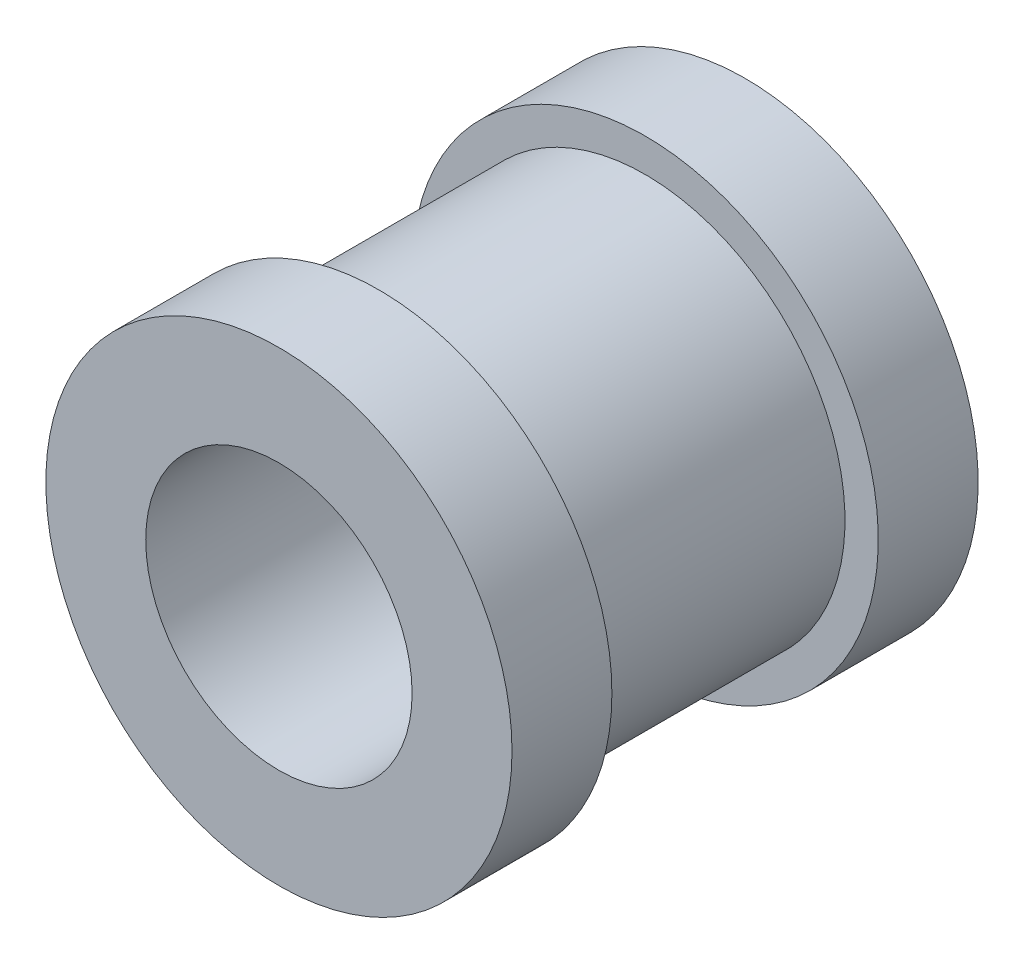
from build123d import *

# Parameters (mm, degrees)
SKETCH1_R           = 6
SKETCH1_R_2         = 4
BOSS_EXTRUDE1_DEPTH = 7
BOSS_EXTRUDE2_START = -3
SKETCH2_R           = 7
SKETCH2_R_2         = 6
BOSS_EXTRUDE2_DEPTH = 3
SKETCH3_R           = 7
SKETCH3_R_2         = 6
BOSS_EXTRUDE3_DEPTH = 3


with BuildPart() as part:
    # Sketch1 → Boss-Extrude1 (new, symmetric)
    with BuildSketch(Plane.XY):
        Circle(SKETCH1_R)
        Circle(SKETCH1_R_2, mode=Mode.SUBTRACT)
    extrude(amount=BOSS_EXTRUDE1_DEPTH, both=True)

    # Sketch2 → Boss-Extrude2 (add)
    with BuildSketch(Plane(origin=(0, 0, -7), x_dir=(-1, 0, 0), z_dir=(0, 0, -1)).offset(BOSS_EXTRUDE2_START)):
        Circle(SKETCH2_R)
        Circle(SKETCH2_R_2, mode=Mode.SUBTRACT)
    extrude(amount=BOSS_EXTRUDE2_DEPTH)

    # Sketch3 → Boss-Extrude3 (add)
    with BuildSketch(Plane.XY.offset(7)):
        Circle(SKETCH3_R)
        Circle(SKETCH3_R_2, mode=Mode.SUBTRACT)
    extrude(amount=-BOSS_EXTRUDE3_DEPTH)


solid = part.part
